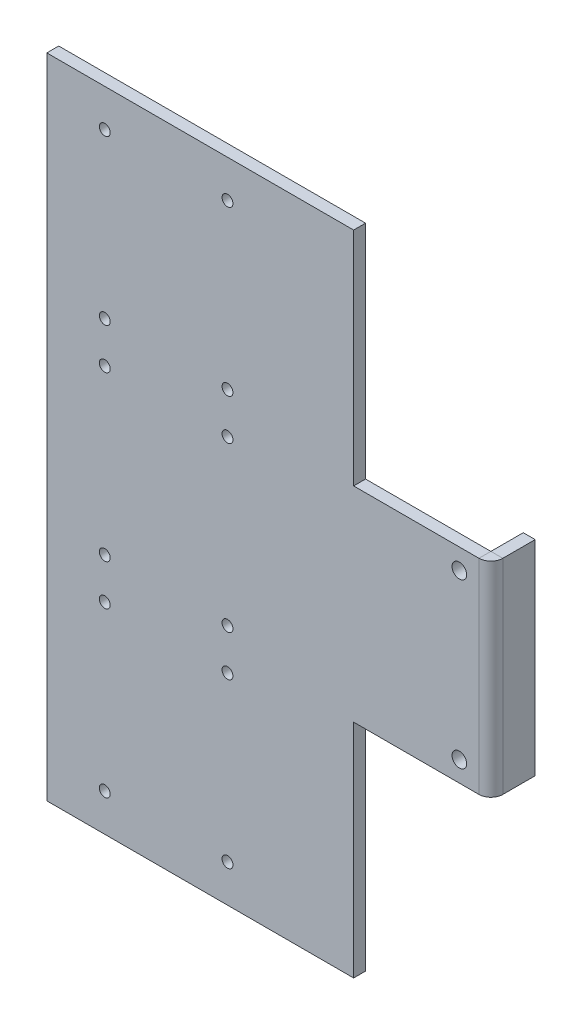
from build123d import *

# Parameters (mm, degrees)
BASE_FLANGIA1_DEPTH                  = 3.5
PIEGATURA_START                      = -30
PIEGATURA_DELLO_SCHIZZO1_DEPTH       = 60
PIEGATURA_DELLO_SCHIZZO1_2_OUTLINE_W = 3.5
PIEGATURA_DELLO_SCHIZZO1_2_OUTLINE_H = 9.495553214
PIEGATURA_DELLO_SCHIZZO1_2_DEPTH     = 60
FORO_PER_VITE_M4_1_D                 = 4.3
FORO_PER_VITE_M4_1_DEPTH             = 20
FORO_PER_VITE_M4_1_TIP               = 1.291850331
FORO_PER_VITE_M3_1_AT_2_COUNT        = 2
FORO_PER_VITE_M3_1_AT_2_PITCH        = 48
FORO_PER_VITE_M3_1_AT_3_COUNT        = 2
FORO_PER_VITE_M3_1_AT_3_PITCH        = 60
FORO_PER_VITE_M3_1_AT_4_COUNT        = 2
FORO_PER_VITE_M3_1_AT_4_PITCH        = 36
RIPETIZIONE_A_L1_COUNT               = 2
RIPETIZIONE_A_L1_PITCH               = 60
RIPETIZIONE_A_L1_COL_COUNT           = 2
RIPETIZIONE_A_L1_COL_PITCH           = 60


# Read off the part's stored shape, not the designer's step: Piegatura dello schizzo1
# Sheet-metal steps are written as plain solids
with BuildPart() as part:
    # Schizzo1 → Base-Flangia1 (new body)
    with BuildSketch(Plane.XY):
        Polygon((-45, 95), (45, 95), (45, 30), (94, 30), (94, -30), (45, -30), (45, -95), (-45, -95), align=None)
    extrude(amount=-BASE_FLANGIA1_DEPTH)

    # Piegatura dello schizzo1 outline → Piegatura dello schizzo1 (cut)
    with BuildSketch(Plane(origin=(0, 0, 0), x_dir=(1, 0, 0), z_dir=(0, 1, 0)).offset(PIEGATURA_START)):
        with BuildLine():
            Line((94, 3.5), (85.255553214, 3.5))
            ThreePointArc((85.255553214, 3.5), (84.230426948, 1.025126266), (81.755553214, 0))
            Line((81.755553214, 0), (94, 0))
            Line((94, 0), (94, 3.5))
        make_face()
    extrude(amount=PIEGATURA_DELLO_SCHIZZO1_DEPTH, mode=Mode.SUBTRACT)

    # Piegatura dello schizzo1 2 outline → Piegatura dello schizzo1 2 (add)
    with BuildSketch(Plane(origin=(0, 0, 0), x_dir=(1, 0, 0), z_dir=(0, 1, 0)).offset(PIEGATURA_START)):
        with Locations((83.505553214, 8.247776607)):
            Rectangle(PIEGATURA_DELLO_SCHIZZO1_2_OUTLINE_W, PIEGATURA_DELLO_SCHIZZO1_2_OUTLINE_H)
    extrude(amount=PIEGATURA_DELLO_SCHIZZO1_2_DEPTH)

    # Foro per Vite M4-1
    with Locations(Plane(origin=(76, 24, 0), x_dir=(1, 0, 0), z_dir=(0, 0, 1))):
        with Locations((0, 0), (0, -48)):
            Hole(FORO_PER_VITE_M4_1_D / 2, depth=FORO_PER_VITE_M4_1_DEPTH)
            with Locations((0, 0, -(FORO_PER_VITE_M4_1_DEPTH + FORO_PER_VITE_M4_1_TIP / 2))):  # 118° drill point
                Cone(0, FORO_PER_VITE_M4_1_D / 2, FORO_PER_VITE_M4_1_TIP, mode=Mode.SUBTRACT)

    # Schizzo9 → Foro per Vite M3-1 (revolve, cut)
    with BuildSketch(Plane(origin=(-28, 24, 0), x_dir=(0, -1, 0), z_dir=(1, 0, 0))):
        Polygon((0, 0), (0, 20.96137699), (1.6, 20), (1.6, 0), align=None)
    foro_per_vite_m3_1 = revolve(axis=Axis((-28, 24, 6.35), (0, 0, -1)), mode=Mode.SUBTRACT)

    # Foro per Vite M3-1 at 2: Foro per Vite M3-1 ×2
    with Locations(*[(0, -i * FORO_PER_VITE_M3_1_AT_2_PITCH, 0) for i in range(1, FORO_PER_VITE_M3_1_AT_2_COUNT)]):
        add(foro_per_vite_m3_1, mode=Mode.SUBTRACT)

    # Foro per Vite M3-1 at 3: Foro per Vite M3-1 ×2
    with Locations(*[Vector(0.6000000000000001, -0.7999999999999999, 0) * (i * FORO_PER_VITE_M3_1_AT_3_PITCH) for i in range(1, FORO_PER_VITE_M3_1_AT_3_COUNT)]):
        add(foro_per_vite_m3_1, mode=Mode.SUBTRACT)

    # Foro per Vite M3-1 at 4: Foro per Vite M3-1 ×2
    with Locations(*[(i * FORO_PER_VITE_M3_1_AT_4_PITCH, 0, 0) for i in range(1, FORO_PER_VITE_M3_1_AT_4_COUNT)]):
        add(foro_per_vite_m3_1, mode=Mode.SUBTRACT)

    # Ripetizione a L1: Foro per Vite M3-1 ×2
    with Locations(*[(0, -i * RIPETIZIONE_A_L1_PITCH, 0) for i in range(1, RIPETIZIONE_A_L1_COUNT)]):
        add(foro_per_vite_m3_1, mode=Mode.SUBTRACT)

    # Ripetizione a L1 copy 1 sketch → Ripetizione a L1 copy 1 (revolve, cut)
    with BuildSketch(Plane(origin=(-28, -84, 0), x_dir=(0, -1, 0), z_dir=(1, 0, 0))):
        Polygon((0, 0), (0, 20.96137699), (1.6, 20), (1.6, 0), align=None)
    revolve(axis=Axis((-28, -84, 6.35), (0, 0, -1)), mode=Mode.SUBTRACT)

    # Ripetizione a L1 copy 2 sketch → Ripetizione a L1 copy 2 (revolve, cut)
    with BuildSketch(Plane(origin=(8, -84, 0), x_dir=(0, -1, 0), z_dir=(1, 0, 0))):
        Polygon((0, 0), (0, 20.96137699), (1.6, 20), (1.6, 0), align=None)
    revolve(axis=Axis((8, -84, 6.35), (0, 0, -1)), mode=Mode.SUBTRACT)

    # Ripetizione a L1 copy 3 sketch → Ripetizione a L1 copy 3 (revolve, cut)
    with BuildSketch(Plane(origin=(8, -36, 0), x_dir=(0, -1, 0), z_dir=(1, 0, 0))):
        Polygon((0, 0), (0, 20.96137699), (1.6, 20), (1.6, 0), align=None)
    revolve(axis=Axis((8, -36, 6.35), (0, 0, -1)), mode=Mode.SUBTRACT)

    # Ripetizione a L1 col: Foro per Vite M3-1 ×2
    with Locations(*[(0, i * RIPETIZIONE_A_L1_COL_PITCH, 0) for i in range(1, RIPETIZIONE_A_L1_COL_COUNT)]):
        add(foro_per_vite_m3_1, mode=Mode.SUBTRACT)

    # Ripetizione a L1 col copy 1 sketch → Ripetizione a L1 col copy 1 (revolve, cut)
    with BuildSketch(Plane(origin=(-28, 36, 0), x_dir=(0, -1, 0), z_dir=(1, 0, 0))):
        Polygon((0, 0), (0, 20.96137699), (1.6, 20), (1.6, 0), align=None)
    revolve(axis=Axis((-28, 36, 6.35), (0, 0, -1)), mode=Mode.SUBTRACT)

    # Ripetizione a L1 col copy 2 sketch → Ripetizione a L1 col copy 2 (revolve, cut)
    with BuildSketch(Plane(origin=(8, 36, 0), x_dir=(0, -1, 0), z_dir=(1, 0, 0))):
        Polygon((0, 0), (0, 20.96137699), (1.6, 20), (1.6, 0), align=None)
    revolve(axis=Axis((8, 36, 6.35), (0, 0, -1)), mode=Mode.SUBTRACT)

    # Ripetizione a L1 col copy 3 sketch → Ripetizione a L1 col copy 3 (revolve, cut)
    with BuildSketch(Plane(origin=(8, 84, 0), x_dir=(0, -1, 0), z_dir=(1, 0, 0))):
        Polygon((0, 0), (0, 20.96137699), (1.6, 20), (1.6, 0), align=None)
    revolve(axis=Axis((8, 84, 6.35), (0, 0, -1)), mode=Mode.SUBTRACT)


solid = part.part
